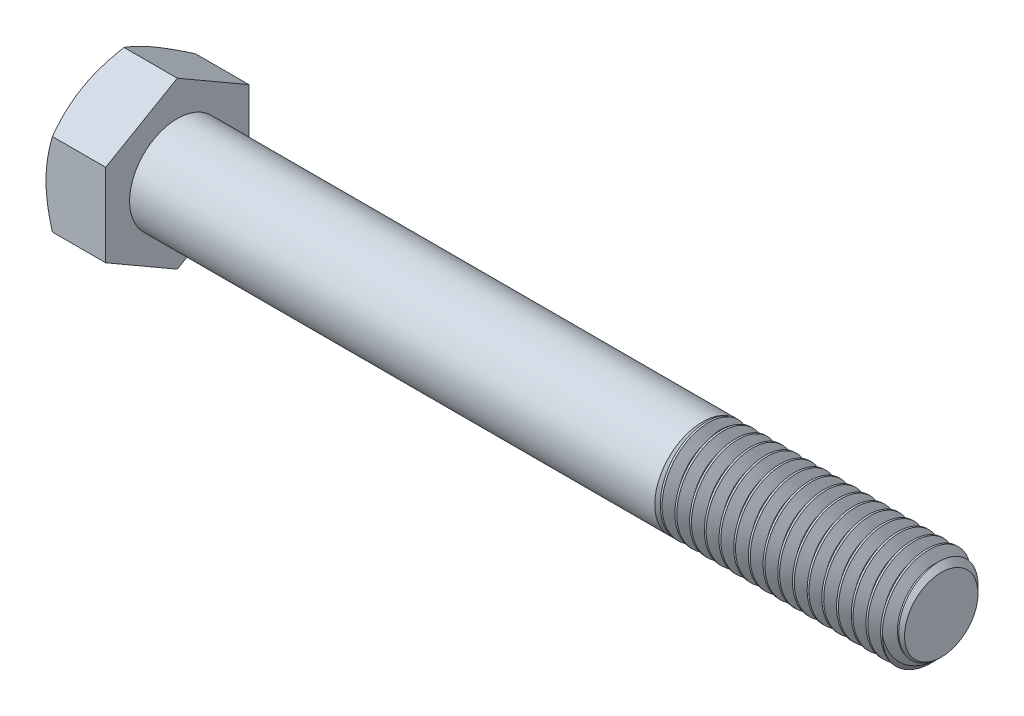
from build123d import *
from build123d.topology import SkipClean

# Parameters (mm, degrees)
SKETCH5_R           = 6.35
BOSS_EXTRUDE3_DEPTH = 101.6
CHAMFER1_SIZE       = 1.465384615
CUT_SWEEP1_PITCH    = 1.953846154
BOSS_EXTRUDE4_DEPTH = 7.9375
SKETCH8_OUTSIDE_W   = 429.964
SKETCH8_OUTSIDE_H   = 432.912
SKETCH8_OUTSIDE_R   = 9.525
CUT_EXTRUDE3_DEPTH  = 111.499579425
CUT_EXTRUDE3_DRAFT  = -60
CUT_EXTRUDE4_DEPTH  = 0.254
CIRPATTERN1_COUNT   = 3


with BuildPart() as part:
    # Sketch5 → Boss-Extrude3 (new body)
    with BuildSketch(Plane(origin=(54.76875, 0, 0), x_dir=(0, 0, -1), z_dir=(1, 0, 0))):
        Circle(SKETCH5_R)
    extrude(amount=-BOSS_EXTRUDE3_DEPTH)

    # Chamfer1
    chamfer1_edges = [part.edges().sort_by_distance(p)[0] for p in [
        (54.76875, 0, 6.35),
    ]]
    chamfer(chamfer1_edges, length=CHAMFER1_SIZE)

    # Cut-Sweep1: the profile of Sketch10 profile screwed along a right-hand helix of 17.25 turns, 10 arcs to a turn; built about Z, then put on its axis
    cut_sweep1_z = Axis((0, 0, 0), (0, 0, 1))
    cut_sweep1_corners = [(6.3503, 0, 0.000173205), (5.080939697, 0, -0.732692308), (5.080939697, 0, -0.976923077), (6.3503, 0, -1.70978859)]
    with BuildLine(mode=Mode.PRIVATE) as cut_sweep1_profile:
        Line(cut_sweep1_corners[0], cut_sweep1_corners[1])
        Line(cut_sweep1_corners[1], cut_sweep1_corners[2])
        Line(cut_sweep1_corners[2], cut_sweep1_corners[3])
        Line(cut_sweep1_corners[3], cut_sweep1_corners[0])
    cut_sweep1_cap = Face(cut_sweep1_profile.wire())
    cut_sweep1_turn_angles = [0, 18, 36, 54, 72, 90, 108, 126, 144, 162, 180, 198, 216, 234, 252, 270, 288, 306, 324, 342, 360]
    cut_sweep1_turn_weights = [1, 0.9510565162951535, 1, 0.9510565162951535, 1, 0.9510565162951535, 1, 0.9510565162951535, 1, 0.9510565162951535, 1, 0.9510565162951535, 1, 0.9510565162951535, 1, 0.9510565162951535, 1, 0.9510565162951535, 1, 0.9510565162951535, 1]
    cut_sweep1_turn_rails = [Edge.make_bspline([Vector(p[0], p[1], 0).rotate(cut_sweep1_z, cut_sweep1_turn_angles[k]) / cut_sweep1_turn_weights[k] + Vector(0, 0, p[2] + CUT_SWEEP1_PITCH * cut_sweep1_turn_angles[k] / 360) for k in range(21)], [0, 0, 0, 1, 1, 2, 2, 3, 3, 4, 4, 5, 5, 6, 6, 7, 7, 8, 8, 9, 9, 10, 10, 10], 2, cut_sweep1_turn_weights) for p in cut_sweep1_corners]
    cut_sweep1_turn_sides = [Face.make_surface_from_curves(cut_sweep1_turn_rails[p[0]], cut_sweep1_turn_rails[p[1]]) for p in [(0, 1), (1, 2), (2, 3), (3, 0)]]
    cut_sweep1_last_angles = [6120, 6138, 6156, 6174, 6192, 6201, 6210]
    cut_sweep1_last_weights = [1, 0.9510565162951535, 1, 0.9510565162951535, 1, 0.9876883405951787, 1]
    cut_sweep1_last_rails = [Edge.make_bspline([Vector(p[0], p[1], 0).rotate(cut_sweep1_z, cut_sweep1_last_angles[k]) / cut_sweep1_last_weights[k] + Vector(0, 0, p[2] + CUT_SWEEP1_PITCH * cut_sweep1_last_angles[k] / 360) for k in range(7)], [0, 0, 0, 1, 1, 2, 2, 3, 3, 3], 2, cut_sweep1_last_weights) for p in cut_sweep1_corners]
    cut_sweep1_last_sides = [Face.make_surface_from_curves(cut_sweep1_last_rails[p[0]], cut_sweep1_last_rails[p[1]]) for p in [(0, 1), (1, 2), (2, 3), (3, 0)]]
    cut_sweep1 = Plane(origin=(54.76875, 0, 0), x_dir=(0, 1, 0), z_dir=(-1, 0, 0)) * Solid(Shell([*[p.moved(Location((0, 0, CUT_SWEEP1_PITCH * i))) for i in range(17) for p in cut_sweep1_turn_sides], *cut_sweep1_last_sides, cut_sweep1_cap, cut_sweep1_cap.rotate(cut_sweep1_z, 6210).moved(Location((0, 0, CUT_SWEEP1_PITCH * 6210 / 360)))]))
    add(cut_sweep1, mode=Mode.SUBTRACT)

    # Sketch11 → Revolve1 (revolve)
    with BuildSketch(Plane.XY, mode=Mode.PRIVATE) as revolve1_sk:
        Polygon((-46.83125, 6.35), (-46.83125, 0), (29.36875, 0), (23.01875, 6.35), align=None)
    revolve(revolve1_sk.sketch.rotate(Axis((-46.83125, 0, 0), (1, 0, 0)), 270), axis=Axis((-46.83125, 0, 0), (1, 0, 0)))

    # Sketch6 → Boss-Extrude4 (add)
    with SkipClean():  # the faces are left unmerged after this step: merging them gives an invalid solid
        with BuildSketch(Plane.ZY.offset(46.83125)):
            Polygon((9.525, 5.499261314), (0, 10.998522628), (-9.525, 5.499261314), (-9.525, -5.499261314), (0, -10.998522628), (9.525, -5.499261314), align=None)
        extrude(amount=BOSS_EXTRUDE4_DEPTH)


with BuildPart() as cut_extrude3_tool:
    # Sketch8 outside → Cut-Extrude3 (with draft: the straight prism first)
    with BuildSketch(Plane.ZY.offset(54.76875)):
        Rectangle(SKETCH8_OUTSIDE_W, SKETCH8_OUTSIDE_H)
        Circle(SKETCH8_OUTSIDE_R, mode=Mode.SUBTRACT)
    extrude(amount=-CUT_EXTRUDE3_DEPTH)
    # Cut-Extrude3: the draft: its side faces are tilted about the plane it starts from
    cut_extrude3_sides = [cut_extrude3_tool.faces().sort_by_distance(p)[0] for p in [
        (0.981039713, -216.456, 0),
        (0.981039713, 0, 214.982),
        (0.981039713, 216.456, 0),
        (0.981039713, 0, -214.982),
        (0.981039713, 0, -9.525),
    ]]
    draft(cut_extrude3_sides, Plane.ZY.offset(54.76875), CUT_EXTRUDE3_DRAFT)


with BuildPart() as part_1:
    add(part.part)

    # Cut-Extrude3: cut by cut_extrude3_tool
    add(cut_extrude3_tool.part, mode=Mode.SUBTRACT)

    # Sketch12 → Cut-Extrude4 (cut)
    with SkipClean():  # the faces are left unmerged after this step: merging them gives an invalid solid
        with BuildSketch(Plane.ZY.offset(54.76875)):
            with BuildLine():
                Line((0.28575, 7.33425), (0.28575, 4.09575))
                ThreePointArc((0.28575, 4.09575), (0, 3.81), (-0.28575, 4.09575))
                Line((-0.28575, 4.09575), (-0.28575, 7.33425))
                ThreePointArc((-0.28575, 7.33425), (0, 7.62), (0.28575, 7.33425))
            make_face()
        cut_extrude4 = extrude(amount=-CUT_EXTRUDE4_DEPTH, mode=Mode.SUBTRACT)

    # CirPattern1: Cut-Extrude4 ×3 about axis
    with SkipClean():  # the faces are left unmerged after this step: merging them gives an invalid solid
        cirpattern1_axis = Axis((0, 0, 0), (1, 0, 0))
        for i in range(1, CIRPATTERN1_COUNT):
            add(cut_extrude4.rotate(cirpattern1_axis, i * 360 / CIRPATTERN1_COUNT), mode=Mode.SUBTRACT)


solid = part_1.part
